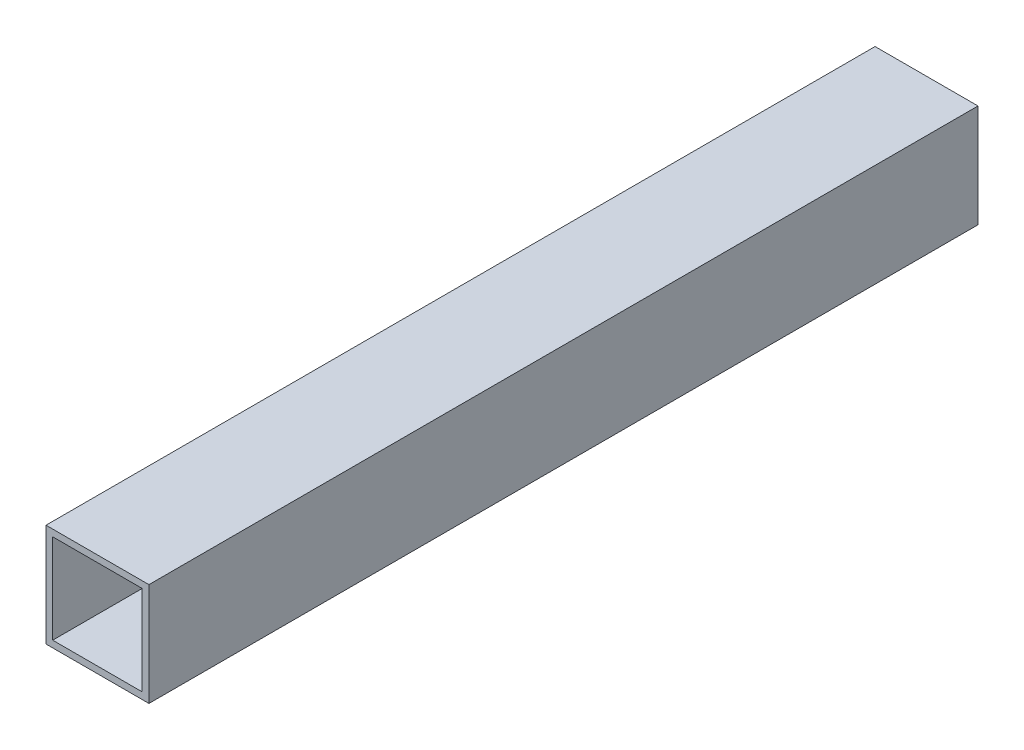
from build123d import *

# Parameters (mm, degrees)
SKETCH1_W           = 25.4
SKETCH1_H           = 25.4
BOSS_EXTRUDE1_DEPTH = 204.6
SHELL1_T            = -1.651


with BuildPart() as part:
    # Sketch1 → Boss-Extrude1 (new body)
    with BuildSketch(Plane.XY):
        with Locations((12.7, 12.7)):
            Rectangle(SKETCH1_W, SKETCH1_H)
    extrude(amount=BOSS_EXTRUDE1_DEPTH)

    # Shell1
    shell1_openings = [part.faces().sort_by_distance(p)[0] for p in [
        (12.7, 12.7, 204.6),
        (12.7, 12.7, 0),
    ]]
    offset(amount=SHELL1_T, openings=shell1_openings, kind=Kind.INTERSECTION)


solid = part.part
